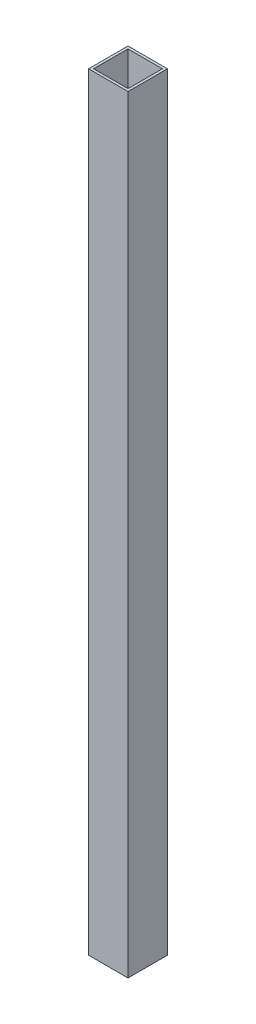
from build123d import *

# Parameters (mm, degrees)
SKETCH1_W           = 19
SKETCH1_H           = 19
SKETCH1_W_2         = 16.6
SKETCH1_H_2         = 16.6
BOSS_EXTRUDE1_DEPTH = 185


with BuildPart() as part:
    # Sketch1 → Boss-Extrude1 (new, symmetric)
    with BuildSketch(Plane(origin=(0, 0, 0), x_dir=(1, 0, 0), z_dir=(0, 1, 0))):
        Rectangle(SKETCH1_W, SKETCH1_H)
        Rectangle(SKETCH1_W_2, SKETCH1_H_2, mode=Mode.SUBTRACT)
    extrude(amount=BOSS_EXTRUDE1_DEPTH, both=True)


solid = part.part
